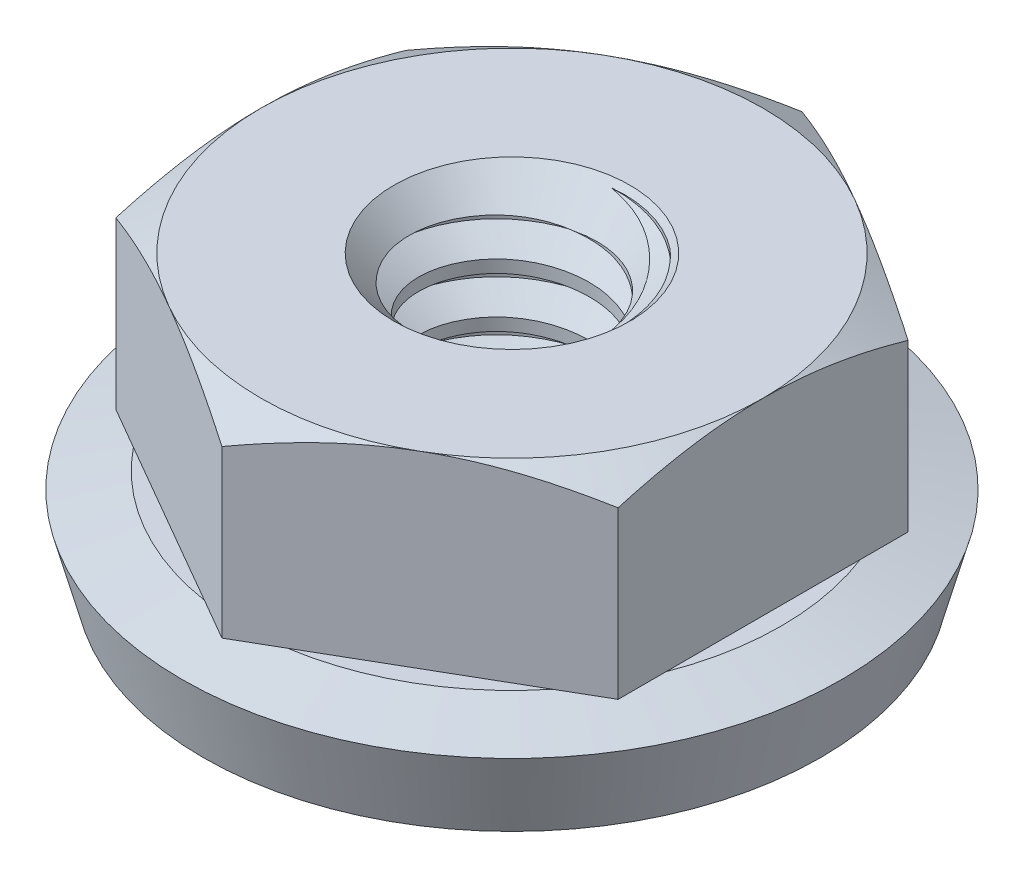
from build123d import *

# Parameters (mm, degrees)
BOSS_EXTRUDE1_DEPTH          = 3.571875
SKETCH2_OUTSIDE_W            = 34.746
SKETCH2_OUTSIDE_H            = 35.728
SKETCH2_OUTSIDE_R            = 3.175
CUT_EXTRUDE1_DEPTH           = 7.023267332
CUT_EXTRUDE1_DRAFT           = -60
SKETCH4_R                    = 1.4224
CUT_EXTRUDE3_DEPTH           = 3.571875
SWEEP1_PITCH                 = 0.635
SKETCH7_R                    = 1.491140766
CUT_EXTRUDE4_OTHER_WAY_DEPTH = 7.433242723
CUT_EXTRUDE4_OTHER_WAY_TAPER = -45
SKETCH8_R                    = 1.491140766
CUT_EXTRUDE5_OTHER_WAY_DEPTH = 7.023267505
CUT_EXTRUDE5_OTHER_WAY_TAPER = -45
SKETCH9_W                    = 1.053149209
SKETCH9_H                    = 1.190625


with BuildPart() as part:
    # Sketch1 → Boss-Extrude1 (new body)
    with BuildSketch(Plane(origin=(0, 0, 0), x_dir=(1, 0, 0), z_dir=(0, 1, 0))):
        Polygon((0, 3.666174209), (-3.175, 1.833087105), (-3.175, -1.833087105), (0, -3.666174209), (3.175, -1.833087105), (3.175, 1.833087105), align=None)
    extrude(amount=BOSS_EXTRUDE1_DEPTH)


with BuildPart() as cut_extrude1_tool:
    # Sketch2 outside → Cut-Extrude1 (with draft: the straight prism first)
    with BuildSketch(Plane(origin=(0, 3.571875, 0), x_dir=(1, 0, 0), z_dir=(0, 1, 0))):
        Rectangle(SKETCH2_OUTSIDE_W, SKETCH2_OUTSIDE_H)
        Circle(SKETCH2_OUTSIDE_R, mode=Mode.SUBTRACT)
    extrude(amount=-CUT_EXTRUDE1_DEPTH)
    # Cut-Extrude1: the draft: its side faces are tilted about the plane it starts from
    cut_extrude1_sides = [cut_extrude1_tool.faces().sort_by_distance(p)[0] for p in [
        (0, 0.060241334, 17.864),
        (17.373, 0.060241334, 0),
        (0, 0.060241334, -17.864),
        (-17.373, 0.060241334, 0),
        (-3.175, 0.060241334, 0),
    ]]
    draft(cut_extrude1_sides, Plane(origin=(0, 3.571875, 0), x_dir=(1, 0, 0), z_dir=(0, 1, 0)), CUT_EXTRUDE1_DRAFT)


with BuildPart() as part_1:
    add(part.part)

    # Cut-Extrude1: cut by cut_extrude1_tool
    add(cut_extrude1_tool.part, mode=Mode.SUBTRACT)

    # Sketch4 → Cut-Extrude3 (cut)
    with BuildSketch(Plane(origin=(0, 3.571875, 0), x_dir=(1, 0, 0), z_dir=(0, 1, 0))):
        with Locations(Location((0, 0, 0), (0, 0, 270))):
            Circle(SKETCH4_R)
    extrude(amount=-CUT_EXTRUDE3_DEPTH, mode=Mode.SUBTRACT)

    # Sweep1: the profile of Sketch6 screwed along a right-hand helix of 6.625 turns, 6 arcs to a turn; built about Z, then put on its axis
    sweep1_z = Axis((0, 0, 0), (0, 0, 1))
    sweep1_corners = [(1.456770383, 0, -0.57546875), (1.078696168, 0, -0.3571875), (1.078696168, 0, -0.1984375), (1.456770383, 0, 0.01984375)]
    with BuildLine(mode=Mode.PRIVATE) as sweep1_profile:
        Line(sweep1_corners[0], sweep1_corners[1])
        Line(sweep1_corners[1], sweep1_corners[2])
        Line(sweep1_corners[2], sweep1_corners[3])
        Line(sweep1_corners[3], sweep1_corners[0])
    sweep1_cap = Face(sweep1_profile.wire())
    sweep1_turn_angles = [0, 30, 60, 90, 120, 150, 180, 210, 240, 270, 300, 330, 360]
    sweep1_turn_weights = [1, 0.8660254037844387, 1, 0.8660254037844387, 1, 0.8660254037844387, 1, 0.8660254037844387, 1, 0.8660254037844387, 1, 0.8660254037844387, 1]
    sweep1_turn_rails = [Edge.make_bspline([Vector(p[0], p[1], 0).rotate(sweep1_z, sweep1_turn_angles[k]) / sweep1_turn_weights[k] + Vector(0, 0, p[2] + SWEEP1_PITCH * sweep1_turn_angles[k] / 360) for k in range(13)], [0, 0, 0, 1, 1, 2, 2, 3, 3, 4, 4, 5, 5, 6, 6, 6], 2, sweep1_turn_weights) for p in sweep1_corners]
    sweep1_turn_sides = [Face.make_surface_from_curves(sweep1_turn_rails[p[0]], sweep1_turn_rails[p[1]]) for p in [(0, 1), (1, 2), (2, 3), (3, 0)]]
    sweep1_last_angles = [2160, 2190, 2220, 2250, 2280, 2310, 2340, 2362.5, 2385]
    sweep1_last_weights = [1, 0.8660254037844387, 1, 0.8660254037844387, 1, 0.8660254037844387, 1, 0.923879532511267, 1]
    sweep1_last_rails = [Edge.make_bspline([Vector(p[0], p[1], 0).rotate(sweep1_z, sweep1_last_angles[k]) / sweep1_last_weights[k] + Vector(0, 0, p[2] + SWEEP1_PITCH * sweep1_last_angles[k] / 360) for k in range(9)], [0, 0, 0, 1, 1, 2, 2, 3, 3, 4, 4, 4], 2, sweep1_last_weights) for p in sweep1_corners]
    sweep1_last_sides = [Face.make_surface_from_curves(sweep1_last_rails[p[0]], sweep1_last_rails[p[1]]) for p in [(0, 1), (1, 2), (2, 3), (3, 0)]]
    sweep1 = Plane(origin=(0, 3.571875, 0), x_dir=(0, 0, -1), z_dir=(0, -1, 0)) * Solid(Shell([*[p.moved(Location((0, 0, SWEEP1_PITCH * i))) for i in range(6) for p in sweep1_turn_sides], *sweep1_last_sides, sweep1_cap, sweep1_cap.rotate(sweep1_z, 2385).moved(Location((0, 0, SWEEP1_PITCH * 2385 / 360)))]))
    add(sweep1)

    # Cut-Extrude4 cone 1 section (through the dimple's axis) → Cut-Extrude4 (revolve, cut)
    with BuildSketch(Plane(origin=(0, 3.571875, 0), x_dir=(0, 0, 1), z_dir=(1, 0, 0))):
        Polygon((0, 0), (1.491140766, 0), (0, 1.491140766), align=None)
    revolve(axis=Axis((0, 3.571875, 0), (0, -1, 0)), mode=Mode.SUBTRACT)

    # Sketch7 → Cut-Extrude4 other way (cut)
    with BuildSketch(Plane(origin=(0, 3.571875, 0), x_dir=(1, 0, 0), z_dir=(0, 1, 0))):
        Circle(SKETCH7_R)
    extrude(amount=CUT_EXTRUDE4_OTHER_WAY_DEPTH, taper=CUT_EXTRUDE4_OTHER_WAY_TAPER, mode=Mode.SUBTRACT)

    # Cut-Extrude5 cone 1 section (through the dimple's axis) → Cut-Extrude5 (revolve, cut)
    with BuildSketch(Plane(origin=(0, 0, 0), x_dir=(0, 0, -1), z_dir=(1, 0, 0))):
        Polygon((0, 0), (1.491140766, 0), (0, 1.491140766), align=None)
    revolve(axis=Axis((0, 0, 0), (0, 1, 0)), mode=Mode.SUBTRACT)

    # Sketch8 → Cut-Extrude5 other way (cut)
    with BuildSketch(Plane.XZ):
        Circle(SKETCH8_R)
    extrude(amount=CUT_EXTRUDE5_OTHER_WAY_DEPTH, taper=CUT_EXTRUDE5_OTHER_WAY_TAPER, mode=Mode.SUBTRACT)

    # Sketch9 → Cut-Revolve1 (revolve, cut)
    with BuildSketch(Plane(origin=(0, 0, 0), x_dir=(0, 0, -1), z_dir=(1, 0, 0)), mode=Mode.PRIVATE) as cut_revolve1_sk:
        with Locations((3.139599605, 0.5953125)):
            Rectangle(SKETCH9_W, SKETCH9_H)
    revolve(cut_revolve1_sk.sketch.rotate(Axis((0, 0, 0), (0, 1, 0)), 256.827375044), axis=Axis((0, 0, 0), (0, 1, 0)), mode=Mode.SUBTRACT)

    # Sketch10 → Revolve1 (revolve)
    with BuildSketch(Plane(origin=(0, 0, 0), x_dir=(0, 0, -1), z_dir=(1, 0, 0)), mode=Mode.PRIVATE) as revolve1_sk:
        Polygon((2.613025, 1.190625), (3.403574918, 1.190625), (4.1671875, 0.986015625), (3.902985409, 0), (3.139372827, 0.204609375), (2.613025, 0.204609375), align=None)
    revolve(revolve1_sk.sketch.rotate(Axis((0, 1.190625, 0), (0, -1, 0)), 103.172624956), axis=Axis((0, 1.190625, 0), (0, -1, 0)))


solid = part_1.part
